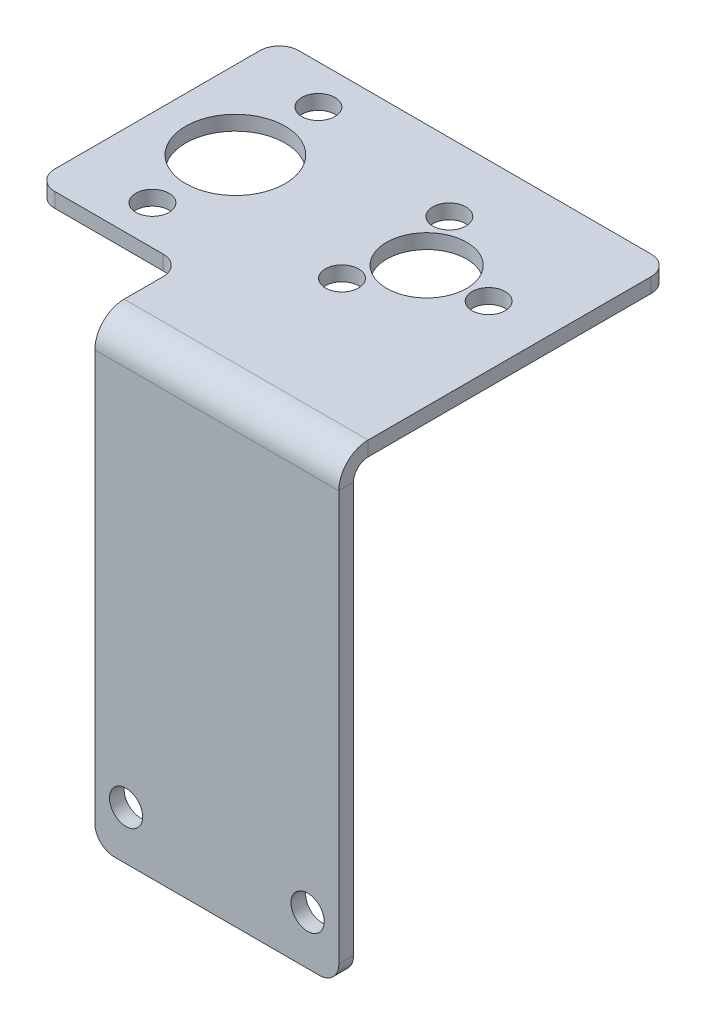
from build123d import *

# Parameters (mm, degrees)
SKETCH1_W            = 41.6
SKETCH1_H            = 1.5
BASE_FLANGE1_DEPTH   = 12.5
M3_CLEARANCE_HOLE2_D = 3.4
M3_CLEARANCE_HOLE3_D = 3.4
SKETCH12_R           = 5.1
SKETCH12_R_2         = 4.1
CUT_EXTRUDE1_DEPTH   = 1.5
EDGE_FLANGE1_DEPTH   = 25
SKETCH22_W           = 1.5
SKETCH22_H           = 25
CUT_EXTRUDE2_DEPTH   = 1.5
FILLET1_R            = 2
M3_CLEARANCE_HOLE4_D = 3.4


# Sheet-metal steps are written as plain solids
with BuildPart() as part:
    # Sketch1 → Base-Flange1 (new, symmetric)
    with BuildSketch(Plane.XY):
        with Locations((20.8, -0.75)):
            Rectangle(SKETCH1_W, SKETCH1_H)
    extrude(amount=BASE_FLANGE1_DEPTH, both=True)

    # M3 Clearance Hole2 (through all)
    with Locations(Plane(origin=(0, -1.5, 0), x_dir=(-1, 0, 0), z_dir=(0, -1, 0))):
        with Locations((-8, -8.5), (-8, 8.5)):
            Hole(M3_CLEARANCE_HOLE2_D / 2)

    # M3 Clearance Hole3 (through all)
    with Locations(Plane(origin=(0, -1.5, 0), x_dir=(-1, 0, 0), z_dir=(0, -1, 0))):
        with Locations((-24.422, -5.499261314), (-33.947, 0), (-24.422, 5.499261314)):
            Hole(M3_CLEARANCE_HOLE3_D / 2)

    # Sketch12 → Cut-Extrude1 (cut)
    with BuildSketch(Plane(origin=(0, 0, 0), x_dir=(1, 0, 0), z_dir=(0, 1, 0))):
        with Locations(Location((8, 0, 0), (0, 0, 270))):
            Circle(SKETCH12_R)
        with Locations(Location((27.597, 0, 0), (0, 0, 270))):
            Circle(SKETCH12_R_2)
    extrude(amount=-CUT_EXTRUDE1_DEPTH, mode=Mode.SUBTRACT)

    # Edge-Flange1 section (across the edge) → Edge-Flange1 (add)
    with BuildSketch(Plane(origin=(40.1, -1.5, 20), x_dir=(0, 0, -1), z_dir=(-1, 0, 0))):
        with BuildLine():
            Line((-1.5, 1.5), (-1.5, 45.5))
            Line((-1.5, 45.5), (0, 45.5))
            Line((0, 45.5), (0, 1.5))
            ThreePointArc((0, 1.5), (0.439339828, 0.439339828), (1.5, 0))
            Line((1.5, 0), (7.5, 0))
            Line((7.5, 0), (7.5, -1.5))
            Line((7.5, -1.5), (1.5, -1.5))
            ThreePointArc((1.5, -1.5), (-0.621320344, -0.621320344), (-1.5, 1.5))
        make_face()
    extrude(amount=EDGE_FLANGE1_DEPTH)

    # Sketch22 → Cut-Extrude2 (cut)
    with BuildSketch(Plane(origin=(0, 0, 0), x_dir=(1, 0, 0), z_dir=(0, 1, 0))):
        with Locations((40.85, 0)):
            Rectangle(SKETCH22_W, SKETCH22_H)
    extrude(amount=-CUT_EXTRUDE2_DEPTH, mode=Mode.SUBTRACT)

    # Fillet1
    fillet1_edges = [part.edges().sort_by_distance(p)[0] for p in [
        (0, -0.75, 12.5),
        (0, -0.75, -12.5),
        (15.1, -0.75, 12.5),
        (40.1, -47, 20.75),
        (15.1, -47, 20.75),
        (40.1, -0.75, -12.5),
    ]]
    fillet(fillet1_edges, radius=FILLET1_R)

    # M3 Clearance Hole4 (through all)
    with Locations(Plane.XY.offset(21.5)):
        with Locations((36.9, -42), (18.3, -42)):
            Hole(M3_CLEARANCE_HOLE4_D / 2)


solid = part.part
